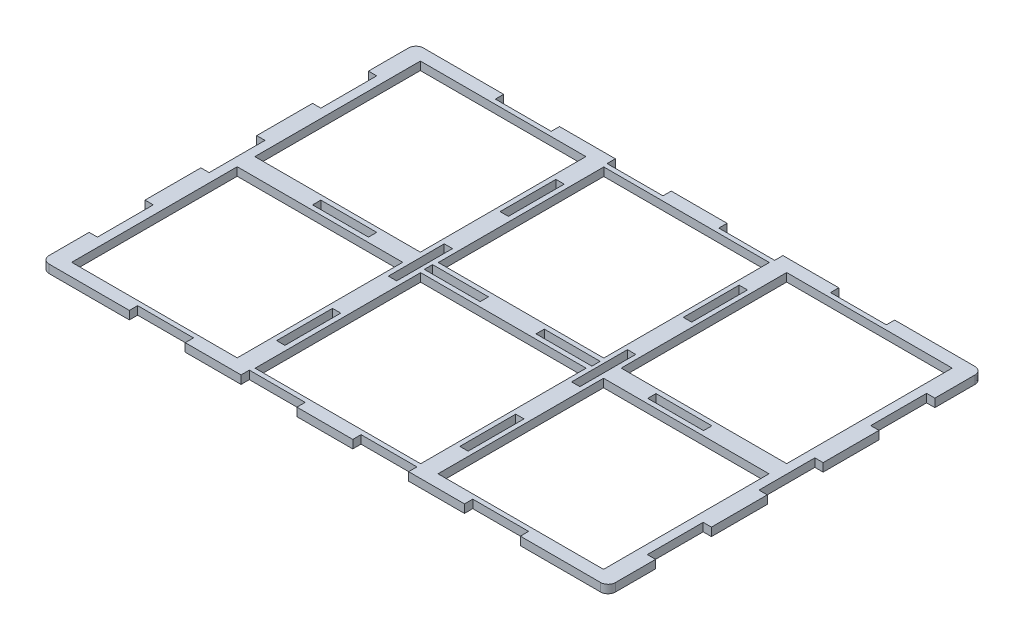
from build123d import *

# Parameters (mm, degrees)
SKETCH1_W                     = 600
SKETCH1_H                     = 400
BOSS_EXTRUDE1_DEPTH           = 6
CUT_EXTRUDE_THIN1_START       = -6
CUT_EXTRUDE_THIN1_OUTLINE_W   = 600
CUT_EXTRUDE_THIN1_OUTLINE_H   = 400
CUT_EXTRUDE_THIN1_OUTLINE_W_2 = 120.00999997
CUT_EXTRUDE_THIN1_OUTLINE_H_2 = 120.00999997
CUT_EXTRUDE_THIN1_OUTLINE_W_3 = 6.010030683
CUT_EXTRUDE_THIN1_OUTLINE_H_3 = 40.510001116
CUT_EXTRUDE_THIN1_OUTLINE_H_4 = 40.510001117
CUT_EXTRUDE_THIN1_OUTLINE_W_4 = 40.510001117
CUT_EXTRUDE_THIN1_OUTLINE_H_5 = 6.010000165
CUT_EXTRUDE_THIN1_OUTLINE_W_5 = 40.510001116
CUT_EXTRUDE_THIN1_DEPTH       = 6


# Read off the part's stored shape, not the designer's step: Cut-Extrude-Thin1
with BuildPart() as part:
    # Sketch1 → Boss-Extrude1 (new body)
    with BuildSketch(Plane(origin=(0, 0, 0), x_dir=(1, 0, 0), z_dir=(0, 1, 0))):
        Rectangle(SKETCH1_W, SKETCH1_H)
    extrude(amount=BOSS_EXTRUDE1_DEPTH)

    # Cut-Extrude-Thin1 outline → Cut-Extrude-Thin1 (cut)
    # profile 1 of 17: a face of its own
    with BuildSketch(Plane(origin=(0, 6, 0), x_dir=(1, 0, 0), z_dir=(0, 1, 0)).offset(CUT_EXTRUDE_THIN1_START)):
        Rectangle(CUT_EXTRUDE_THIN1_OUTLINE_W, CUT_EXTRUDE_THIN1_OUTLINE_H)
        with BuildLine():
            add(Edge.make_bspline(
                [(-238.36591917, -110.666330439), (-238.36591917, -111.022718254), (-238.331611138, -111.373302275), (-238.229439172, -111.890599849), (-238.186888618, -112.061595598), (-238.084359635, -112.40063887), (-238.024094249, -112.569133555), (-237.820904778, -113.059142484), (-237.654940907, -113.36891683), (-237.263040055, -113.955242515), (-237.035095444, -114.232830805), (-236.537438909, -114.730832851), (-236.266010557, -114.954536306), (-235.676648855, -115.349887512), (-235.363009478, -115.517926842), (-234.714230084, -115.787625448), (-234.374802575, -115.891216057), (-233.677199742, -116.029834842), (-233.324541074, -116.06414949), (-232.96810012, -116.06414949)],
                knots=[0, 0, 0, 0, 0.125, 0.125, 0.1875, 0.1875, 0.25, 0.25, 0.375, 0.375, 0.5, 0.5, 0.625, 0.625, 0.75, 0.75, 0.875, 0.875, 1, 1, 1, 1], degree=3))
            Line((-238.36591917, -110.666330439), (-238.36591917, -81.619146709))
            Line((-238.36591917, -81.619146709), (-232.365919004, -81.619146709))
            Line((-232.365919004, -81.619146709), (-232.365919004, -41.109145592))
            Line((-232.365919004, -41.109145592), (-238.36591917, -41.109145592))
            Line((-238.36591917, -41.109145592), (-238.36591917, -0.619144476))
            Line((-238.36591917, -0.619144476), (-232.365919004, -0.619144476))
            Line((-232.365919004, -0.619144476), (-232.365919004, 39.890856641))
            Line((-232.365919004, 39.890856641), (-238.36591917, 39.890856641))
            Line((-238.36591917, 39.890856641), (-238.36591917, 80.380857757))
            Line((-238.36591917, 80.380857757), (-232.365919004, 80.380857757))
            Line((-232.365919004, 80.380857757), (-232.365919004, 120.890858873))
            Line((-232.365919004, 120.890858873), (-238.36591917, 120.890858873))
            Line((-238.36591917, 120.890858873), (-238.36591917, 149.945450012))
            add(Edge.make_bspline(
                [(-232.975507527, 155.335861654), (-233.331406272, 155.335861654), (-233.681509188, 155.301600704), (-234.198096877, 155.199568948), (-234.368857969, 155.157076787), (-234.707435973, 155.054688504), (-234.875699433, 154.99450582), (-235.365035925, 154.791595185), (-235.674385168, 154.625859065), (-236.259906241, 154.234496016), (-236.537113597, 154.006864213), (-237.034432237, 153.50989061), (-237.257828705, 153.238834738), (-237.652637373, 152.650281815), (-237.820446103, 152.337072845), (-238.089774603, 151.689183769), (-238.193223055, 151.350222055), (-238.331651613, 150.653576539), (-238.36591917, 150.301401824), (-238.36591917, 149.945450012)],
                knots=[0, 0, 0, 0, 0.125, 0.125, 0.1875, 0.1875, 0.25, 0.25, 0.375, 0.375, 0.5, 0.5, 0.625, 0.625, 0.75, 0.75, 0.875, 0.875, 1, 1, 1, 1], degree=3))
            Line((-232.975507527, 155.335861654), (-174.770917874, 155.335861654))
            Line((-174.770917874, 155.335861654), (-174.770917874, 149.335861489))
            Line((-174.770917874, 149.335861489), (-134.260912943, 149.335861489))
            Line((-134.260912943, 149.335861489), (-134.260912943, 155.335861654))
            Line((-134.260912943, 155.335861654), (-93.770919456, 155.335861654))
            Line((-93.770919456, 155.335861654), (-93.770919456, 149.335861489))
            Line((-93.770919456, 149.335861489), (-53.26091834, 149.335861489))
            Line((-53.26091834, 149.335861489), (-53.26091834, 155.335861654))
            Line((-53.26091834, 155.335861654), (-12.770917223, 155.335861654))
            Line((-12.770917223, 155.335861654), (-12.770917223, 149.335861489))
            Line((-12.770917223, 149.335861489), (27.739099152, 149.335861489))
            Line((27.739099152, 149.335861489), (27.739099152, 155.335861654))
            Line((27.739099152, 155.335861654), (68.229100268, 155.335861654))
            Line((68.229100268, 155.335861654), (68.229100268, 149.335861489))
            Line((68.229100268, 149.335861489), (108.739101385, 149.335861489))
            Line((108.739101385, 149.335861489), (108.739101385, 155.335861654))
            Line((108.739101385, 155.335861654), (166.94069191, 155.335861654))
            add(Edge.make_bspline(
                [(172.334083607, 149.942469958), (172.334083607, 150.298565459), (172.299803715, 150.648861927), (172.197715552, 151.165735208), (172.155199899, 151.336590704), (172.052755011, 151.675355888), (171.992539056, 151.843712372), (171.789516243, 152.33331939), (171.623688497, 152.642839656), (171.232109086, 153.22868443), (171.004351438, 153.506045038), (170.507103087, 154.003638617), (170.235897363, 154.227158588), (169.647019062, 154.622185524), (169.333636936, 154.790087026), (168.685389679, 155.059564422), (168.346240572, 155.163070064), (167.649209921, 155.301575153), (167.296840508, 155.335861654), (166.94069191, 155.335861654)],
                knots=[0, 0, 0, 0, 0.125, 0.125, 0.1875, 0.1875, 0.25, 0.25, 0.375, 0.375, 0.5, 0.5, 0.625, 0.625, 0.75, 0.75, 0.875, 0.875, 1, 1, 1, 1], degree=3))
            Line((172.334083607, 149.942469958), (172.334083607, 120.890858873))
            Line((172.334083607, 120.890858873), (166.334083441, 120.890858873))
            Line((166.334083441, 120.890858873), (166.334083441, 80.380857757))
            Line((166.334083441, 80.380857757), (172.334083607, 80.380857757))
            Line((172.334083607, 80.380857757), (172.334083607, 39.890856641))
            Line((172.334083607, 39.890856641), (166.334083441, 39.890856641))
            Line((166.334083441, 39.890856641), (166.334083441, -0.619144476))
            Line((166.334083441, -0.619144476), (172.334083607, -0.619144476))
            Line((172.334083607, -0.619144476), (172.334083607, -41.109145592))
            Line((172.334083607, -41.109145592), (166.334083441, -41.109145592))
            Line((166.334083441, -41.109145592), (166.334083441, -81.619146709))
            Line((166.334083441, -81.619146709), (172.334083607, -81.619146709))
            Line((172.334083607, -81.619146709), (172.334083607, -110.670699923))
            add(Edge.make_bspline(
                [(166.94063404, -116.06414949), (167.296733362, -116.06414949), (167.647033588, -116.02986923), (168.163912416, -115.927779971), (168.334769745, -115.885263862), (168.673538564, -115.782817875), (168.841896854, -115.722601274), (169.331509126, -115.519576283), (169.641032712, -115.353746757), (170.226883772, -114.962163145), (170.504247357, -114.734403053), (171.001846275, -114.237149366), (171.225368645, -113.965940733), (171.620399819, -113.377056114), (171.788303122, -113.063670625), (172.05778341, -112.415416412), (172.161290163, -112.076263666), (172.299796737, -111.379225535), (172.334083607, -111.026852342), (172.334083607, -110.670699923)],
                knots=[0, 0, 0, 0, 0.125, 0.125, 0.1875, 0.1875, 0.25, 0.25, 0.375, 0.375, 0.5, 0.5, 0.625, 0.625, 0.75, 0.75, 0.875, 0.875, 1, 1, 1, 1], degree=3))
            Line((166.94063404, -116.06414949), (108.739101385, -116.06414949))
            Line((108.739101385, -116.06414949), (108.739101385, -110.064149324))
            Line((108.739101385, -110.064149324), (68.229100268, -110.064149324))
            Line((68.229100268, -110.064149324), (68.229100268, -116.06414949))
            Line((68.229100268, -116.06414949), (27.739099152, -116.06414949))
            Line((27.739099152, -116.06414949), (27.739099152, -110.064149324))
            Line((27.739099152, -110.064149324), (-12.770917223, -110.064149324))
            Line((-12.770917223, -110.064149324), (-12.770917223, -116.06414949))
            Line((-12.770917223, -116.06414949), (-53.26091834, -116.06414949))
            Line((-53.26091834, -116.06414949), (-53.26091834, -110.064149324))
            Line((-53.26091834, -110.064149324), (-93.770919456, -110.064149324))
            Line((-93.770919456, -110.064149324), (-93.770919456, -116.06414949))
            Line((-93.770919456, -116.06414949), (-134.260912943, -116.06414949))
            Line((-134.260912943, -116.06414949), (-134.260912943, -110.064149324))
            Line((-134.260912943, -110.064149324), (-174.770917874, -110.064149324))
            Line((-174.770917874, -110.064149324), (-174.770917874, -116.06414949))
            Line((-174.770917874, -116.06414949), (-232.96810012, -116.06414949))
        make_face(mode=Mode.SUBTRACT)
    # profile 2 of 17: a face of its own
    with BuildSketch(Plane(origin=(0, 6, 0), x_dir=(1, 0, 0), z_dir=(0, 1, 0)).offset(CUT_EXTRUDE_THIN1_START)):
        with Locations((99.734498143, -46.752338346)):
            Rectangle(CUT_EXTRUDE_THIN1_OUTLINE_W_2, CUT_EXTRUDE_THIN1_OUTLINE_H_2)
    # profile 3 of 17: a face of its own
    with BuildSketch(Plane(origin=(0, 6, 0), x_dir=(1, 0, 0), z_dir=(0, 1, 0)).offset(CUT_EXTRUDE_THIN1_START)):
        with Locations((-32.878833462, -46.752338346)):
            Rectangle(CUT_EXTRUDE_THIN1_OUTLINE_W_2, CUT_EXTRUDE_THIN1_OUTLINE_H_2)
    # profile 4 of 17: a face of its own
    with BuildSketch(Plane(origin=(0, 6, 0), x_dir=(1, 0, 0), z_dir=(0, 1, 0)).offset(CUT_EXTRUDE_THIN1_START)):
        with Locations((-165.879682281, -46.752338346)):
            Rectangle(CUT_EXTRUDE_THIN1_OUTLINE_W_2, CUT_EXTRUDE_THIN1_OUTLINE_H_2)
    # profile 5 of 17: a face of its own
    with BuildSketch(Plane(origin=(0, 6, 0), x_dir=(1, 0, 0), z_dir=(0, 1, 0)).offset(CUT_EXTRUDE_THIN1_START)):
        with Locations((33.442531415, 100.635858315)):
            Rectangle(CUT_EXTRUDE_THIN1_OUTLINE_W_3, CUT_EXTRUDE_THIN1_OUTLINE_H_3)
    # profile 6 of 17: a face of its own
    with BuildSketch(Plane(origin=(0, 6, 0), x_dir=(1, 0, 0), z_dir=(0, 1, 0)).offset(CUT_EXTRUDE_THIN1_START)):
        with Locations((33.442531415, 19.635856082)):
            Rectangle(CUT_EXTRUDE_THIN1_OUTLINE_W_3, CUT_EXTRUDE_THIN1_OUTLINE_H_4)
    # profile 7 of 17: a face of its own
    with BuildSketch(Plane(origin=(0, 6, 0), x_dir=(1, 0, 0), z_dir=(0, 1, 0)).offset(CUT_EXTRUDE_THIN1_START)):
        with Locations((33.442531415, -61.364146151)):
            Rectangle(CUT_EXTRUDE_THIN1_OUTLINE_W_3, CUT_EXTRUDE_THIN1_OUTLINE_H_4)
    # profile 8 of 17: a face of its own
    with BuildSketch(Plane(origin=(0, 6, 0), x_dir=(1, 0, 0), z_dir=(0, 1, 0)).offset(CUT_EXTRUDE_THIN1_START)):
        with Locations((-99.406534011, -61.363913878)):
            Rectangle(CUT_EXTRUDE_THIN1_OUTLINE_W_3, CUT_EXTRUDE_THIN1_OUTLINE_H_3)
    # profile 9 of 17: a face of its own
    with BuildSketch(Plane(origin=(0, 6, 0), x_dir=(1, 0, 0), z_dir=(0, 1, 0)).offset(CUT_EXTRUDE_THIN1_START)):
        with Locations((-99.406534011, 19.636088355)):
            Rectangle(CUT_EXTRUDE_THIN1_OUTLINE_W_3, CUT_EXTRUDE_THIN1_OUTLINE_H_3)
    # profile 10 of 17: a face of its own
    with BuildSketch(Plane(origin=(0, 6, 0), x_dir=(1, 0, 0), z_dir=(0, 1, 0)).offset(CUT_EXTRUDE_THIN1_START)):
        with Locations((-99.406534011, 100.636090588)):
            Rectangle(CUT_EXTRUDE_THIN1_OUTLINE_W_3, CUT_EXTRUDE_THIN1_OUTLINE_H_3)
    # profile 11 of 17: a face of its own
    with BuildSketch(Plane(origin=(0, 6, 0), x_dir=(1, 0, 0), z_dir=(0, 1, 0)).offset(CUT_EXTRUDE_THIN1_START)):
        with Locations((-73.349436431, 19.635856083)):
            Rectangle(CUT_EXTRUDE_THIN1_OUTLINE_W_4, CUT_EXTRUDE_THIN1_OUTLINE_H_5)
    # profile 12 of 17: a face of its own
    with BuildSketch(Plane(origin=(0, 6, 0), x_dir=(1, 0, 0), z_dir=(0, 1, 0)).offset(CUT_EXTRUDE_THIN1_START)):
        with Locations((-154.349438663, 19.635856083)):
            Rectangle(CUT_EXTRUDE_THIN1_OUTLINE_W_5, CUT_EXTRUDE_THIN1_OUTLINE_H_5)
    # profile 13 of 17: a face of its own
    with BuildSketch(Plane(origin=(0, 6, 0), x_dir=(1, 0, 0), z_dir=(0, 1, 0)).offset(CUT_EXTRUDE_THIN1_START)):
        with Locations((88.650568035, 19.635856083)):
            Rectangle(CUT_EXTRUDE_THIN1_OUTLINE_W_5, CUT_EXTRUDE_THIN1_OUTLINE_H_5)
    # profile 14 of 17: a face of its own
    with BuildSketch(Plane(origin=(0, 6, 0), x_dir=(1, 0, 0), z_dir=(0, 1, 0)).offset(CUT_EXTRUDE_THIN1_START)):
        with Locations((7.650565803, 19.635856083)):
            Rectangle(CUT_EXTRUDE_THIN1_OUTLINE_W_4, CUT_EXTRUDE_THIN1_OUTLINE_H_5)
    # profile 15 of 17: a face of its own
    with BuildSketch(Plane(origin=(0, 6, 0), x_dir=(1, 0, 0), z_dir=(0, 1, 0)).offset(CUT_EXTRUDE_THIN1_START)):
        with Locations((-32.849435314, 86.02405051)):
            Rectangle(CUT_EXTRUDE_THIN1_OUTLINE_W_2, CUT_EXTRUDE_THIN1_OUTLINE_H_2)
    # profile 16 of 17: a face of its own
    with BuildSketch(Plane(origin=(0, 6, 0), x_dir=(1, 0, 0), z_dir=(0, 1, 0)).offset(CUT_EXTRUDE_THIN1_START)):
        with Locations((99.763896291, 86.02405051)):
            Rectangle(CUT_EXTRUDE_THIN1_OUTLINE_W_2, CUT_EXTRUDE_THIN1_OUTLINE_H_2)
    # profile 17 of 17: a face of its own
    with BuildSketch(Plane(origin=(0, 6, 0), x_dir=(1, 0, 0), z_dir=(0, 1, 0)).offset(CUT_EXTRUDE_THIN1_START)):
        with Locations((-165.850284133, 86.02405051)):
            Rectangle(CUT_EXTRUDE_THIN1_OUTLINE_W_2, CUT_EXTRUDE_THIN1_OUTLINE_H_2)
    extrude(amount=CUT_EXTRUDE_THIN1_DEPTH, mode=Mode.SUBTRACT)


solid = part.part
